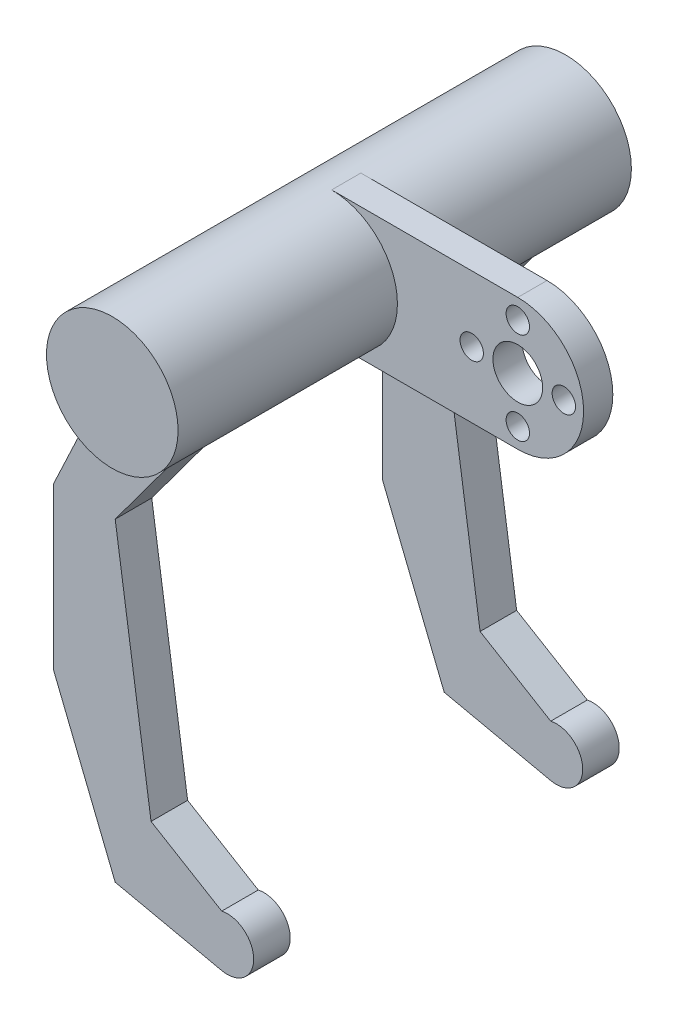
from build123d import *

# Parameters (mm, degrees)
SKETCH2_R                = 11.43
BOSS_EXTRUDE1_DEPTH      = 5.08
BOSS_EXTRUDE2_DEPTH      = 5.08
SKETCH4_R                = 4.318
SKETCH4_R_2              = 2.032
CUT_EXTRUDE1_DEPTH       = 5.08
CIRPATTERN1_COUNT        = 4
BOSS_EXTRUDE3_DEPTH      = 38.1
BOSS_EXTRUDE3_DEPTH_BACK = 40.64
SKETCH9_R                = 11.43
BOSS_EXTRUDE4_DEPTH      = 6.35


with BuildPart() as part:
    # Sketch2 → Boss-Extrude1 (new body)
    with BuildSketch(Plane.XY):
        Circle(SKETCH2_R)
    extrude(amount=BOSS_EXTRUDE1_DEPTH)

    # Sketch7 → Boss-Extrude2 (add)
    with BuildSketch(Plane(origin=(0, 0, 0), x_dir=(-1, 0, 0), z_dir=(0, 0, -1))):
        with BuildLine():
            Line((0, 11.43), (32.334928423, 11.43))
            ThreePointArc((32.334928423, 11.43), (43.764928423, 0), (32.334928423, -11.43))
            Line((32.334928423, -11.43), (0, -11.43))
            Line((0, -11.43), (0, 11.43))
        make_face()
    extrude(amount=-BOSS_EXTRUDE2_DEPTH)

    # Sketch4 → Cut-Extrude1 (cut)
    with BuildSketch(Plane(origin=(0, 0, 0), x_dir=(-1, 0, 0), z_dir=(0, 0, -1))):
        Circle(SKETCH4_R)
        with Locations((0, -8.001)):
            Circle(SKETCH4_R_2)
    cut_extrude1 = extrude(amount=-CUT_EXTRUDE1_DEPTH, mode=Mode.SUBTRACT)

    # CirPattern1: Cut-Extrude1 ×4 about axis
    cirpattern1_axis = Axis((0, 0, 5.08), (0, 0, -1))
    for i in range(1, CIRPATTERN1_COUNT):
        add(cut_extrude1.rotate(cirpattern1_axis, i * 360 / CIRPATTERN1_COUNT), mode=Mode.SUBTRACT)

    # Sketch9 → Boss-Extrude3 (add, two sides: drawn at the far end of the back side and taken through both)
    with BuildSketch(Plane.XY.offset(5.08).offset(-BOSS_EXTRUDE3_DEPTH_BACK)):
        with Locations((-32.334928423, 0)):
            Circle(SKETCH9_R)
    extrude(amount=BOSS_EXTRUDE3_DEPTH + BOSS_EXTRUDE3_DEPTH_BACK)

    # Sketch10 → Boss-Extrude4 (add)
    with BuildSketch(Plane.XY.offset(-31.75)):
        with BuildLine():
            Line((-37.028733454, -72.582202646), (-43.258278065, -30.219589225))
            Line((-43.258278065, -30.219589225), (-20.904928423, 0))
            Line((-20.904928423, 0), (-32.171436877, 0.015474968))
            Line((-32.171436877, 0.015474968), (-39.730825163, 0.025858069))
            Line((-39.730825163, 0.025858069), (-53.950343023, -30.219589225))
            Line((-53.950343023, -30.219589225), (-53.950343023, -58.308345581))
            Line((-53.950343023, -58.308345581), (-43.258278065, -84.842076202))
            Line((-43.258278065, -84.842076202), (-24.756596451, -88.874141931))
            ThreePointArc((-24.756596451, -88.874141931), (-19.207535115, -84.404142538), (-24.756596451, -79.934143145))
            Line((-24.756596451, -79.934143145), (-37.028733454, -72.582202646))
        make_face()
    boss_extrude4 = extrude(amount=BOSS_EXTRUDE4_DEPTH)

    # Mirror1: Boss-Extrude4 across plane
    add(boss_extrude4.mirror(Plane.XY))


solid = part.part
